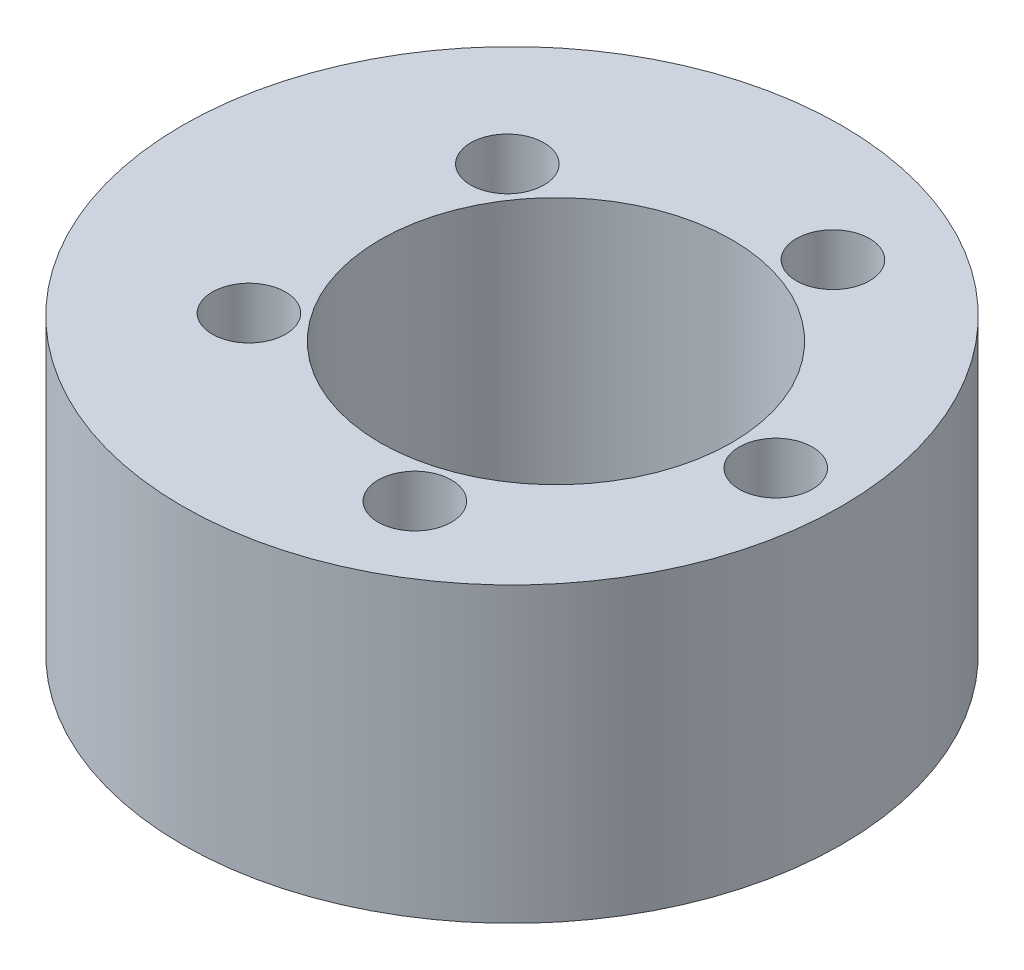
from build123d import *

# Parameters (mm, degrees)
SKETCH1_R           = 22.5
SKETCH1_R_2         = 2.5
SKETCH1_R_3         = 12
BOSS_EXTRUDE1_DEPTH = 20
SKETCH2_R           = 18
SKETCH2_R_2         = 2.5
SKETCH2_R_3         = 12
CUT_EXTRUDE1_DEPTH  = 3


with BuildPart() as part:
    # Sketch1 → Boss-Extrude1 (new body)
    with BuildSketch(Plane(origin=(0, 0, 0), x_dir=(1, 0, 0), z_dir=(0, 1, 0))):
        Circle(SKETCH1_R)
        with Locations((-9.135254916, -8.816778784)):
            Circle(SKETCH1_R_2, mode=Mode.SUBTRACT)
        with Locations((7.635254916, -14.265847744)):
            Circle(SKETCH1_R_2, mode=Mode.SUBTRACT)
        with Locations((-9.135254916, 8.816778784)):
            Circle(SKETCH1_R_2, mode=Mode.SUBTRACT)
        with Locations((3, 0)):
            Circle(SKETCH1_R_3, mode=Mode.SUBTRACT)
        with BuildLine():
            ThreePointArc((15.5, 0), (18, 2.5), (20.5, 0))
            ThreePointArc((20.5, 0), (18, -2.5), (15.5, 0))
        make_face(mode=Mode.SUBTRACT)
        with Locations((7.635254916, 14.265847744)):
            Circle(SKETCH1_R_2, mode=Mode.SUBTRACT)
    extrude(amount=BOSS_EXTRUDE1_DEPTH)

    # Sketch2 → Cut-Extrude1 (cut)
    with BuildSketch(Plane.XZ):
        with Locations((3, 0)):
            Circle(SKETCH2_R)
        with Locations((-9.135254916, -8.816778784)):
            Circle(SKETCH2_R_2, mode=Mode.SUBTRACT)
        with Locations((7.635254916, -14.265847744)):
            Circle(SKETCH2_R_2, mode=Mode.SUBTRACT)
        with Locations((-9.135254916, 8.816778784)):
            Circle(SKETCH2_R_2, mode=Mode.SUBTRACT)
        with Locations((3, 0)):
            Circle(SKETCH2_R_3, mode=Mode.SUBTRACT)
        with BuildLine():
            ThreePointArc((15.5, 0), (18, 2.5), (20.5, 0))
            ThreePointArc((20.5, 0), (18, -2.5), (15.5, 0))
        make_face(mode=Mode.SUBTRACT)
        with Locations((7.635254916, 14.265847744)):
            Circle(SKETCH2_R_2, mode=Mode.SUBTRACT)
    extrude(amount=-CUT_EXTRUDE1_DEPTH, mode=Mode.SUBTRACT)


solid = part.part
